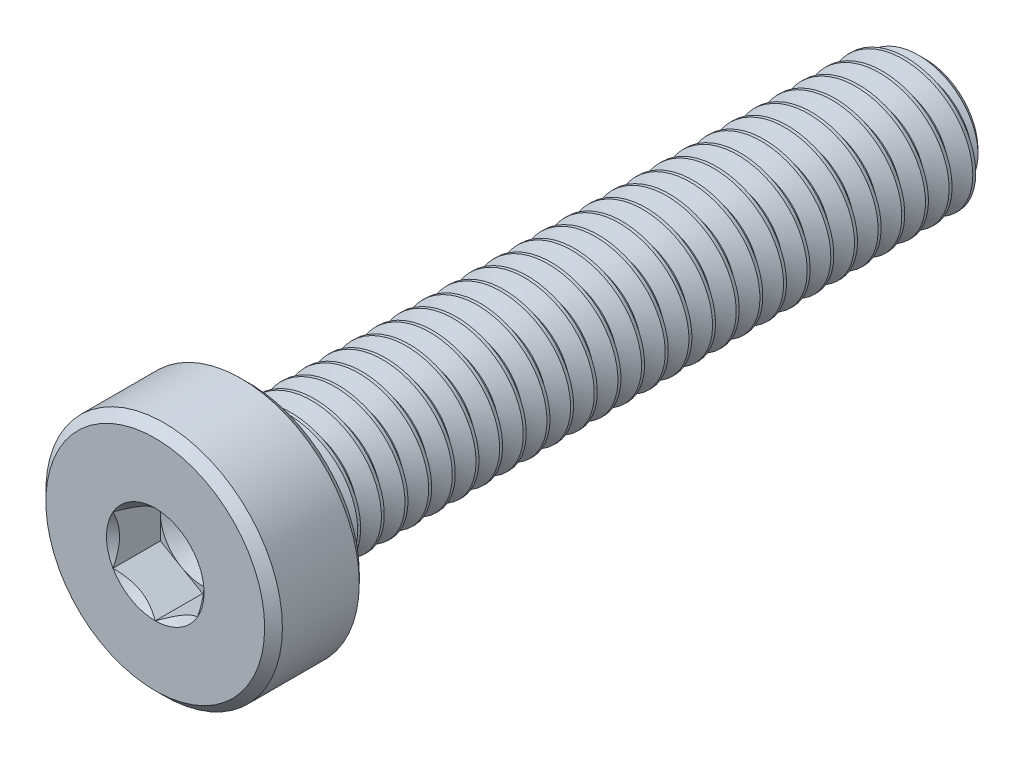
from build123d import *

# Parameters (mm, degrees)
CUT_EXTRUDE1_DEPTH = 1.4
CUT_SWEEP1_PITCH   = 0.7


with BuildPart() as part:
    # Sketch2 → Revolve1 (revolve)
    with BuildSketch(Plane(origin=(0, 0, 0), x_dir=(0, 0, -1), z_dir=(1, 0, 0)), mode=Mode.PRIVATE) as revolve1_sk:
        with BuildLine():
            Line((-8.8625, 3.5), (-8.6, 3.2375))
            Line((-8.6, 3.2375), (-8.6, 2.2))
            ThreePointArc((-8.6, 2.2), (-8.541421356, 2.058578644), (-8.4, 2))
            Line((-8.4, 2), (10.945336663, 2))
            Line((10.945336663, 2), (11.4, 1.545336663))
            Line((11.4, 1.545336663), (11.4, 0))
            Line((11.4, 0), (-10, 0))
            Line((-10, 0), (-10, 1.25))
            Line((-10, 1.25), (-11.4, 1.25))
            Line((-11.4, 1.25), (-11.4, 3.2375))
            Line((-11.4, 3.2375), (-11.1375, 3.5))
            Line((-11.1375, 3.5), (-8.8625, 3.5))
        make_face()
    revolve(revolve1_sk.sketch.rotate(Axis((0, 0, 10), (0, 0, -1)), 90), axis=Axis((0, 0, 10), (0, 0, -1)))

    # Sketch3 → Cut-Extrude1 (cut)
    with BuildSketch(Plane.XY.offset(11.4)):
        Polygon((0, 1.443375673), (-1.25, 0.721687836), (-1.25, -0.721687836), (0, -1.443375673), (1.25, -0.721687836), (1.25, 0.721687836), align=None)
    extrude(amount=-CUT_EXTRUDE1_DEPTH, mode=Mode.SUBTRACT)

    # Cut-Extrude2 cone 1 section (through the dimple's axis) → Cut-Extrude2 (revolve, cut)
    with BuildSketch(Plane(origin=(0, 0, 11.4), x_dir=(0, -1, 0), z_dir=(1, 0, 0))):
        Polygon((0, 0), (1.443375673, 0), (0, 1.443375673), align=None)
    revolve(axis=Axis((0, 0, 11.4), (0, 0, -1)), mode=Mode.SUBTRACT)

    # Cut-Extrude5 cone 1 section (through the dimple's axis) → Cut-Extrude5 (revolve, cut)
    with BuildSketch(Plane(origin=(0, 0, 10), x_dir=(0, -1, 0), z_dir=(1, 0, 0))):
        Polygon((0, 0), (1.25, 0), (0, 0.721687836), align=None)
    revolve(axis=Axis((0, 0, 10), (0, 0, -1)), mode=Mode.SUBTRACT)

    # Cut-Sweep1: the profile of Sketch8 screwed along a right-hand helix of 29.196429 turns, 6 arcs to a turn; built about Z, then put on its axis
    cut_sweep1_z = Axis((0, 0, 0), (0, 0, 1))
    cut_sweep1_corners = [(2.037888611, 0, 0.021875), (2.037888611, 0, -0.634375), (1.545336663, 0, -0.35), (1.545336663, 0, -0.2625)]
    with BuildLine(mode=Mode.PRIVATE) as cut_sweep1_profile:
        Line(cut_sweep1_corners[0], cut_sweep1_corners[1])
        Line(cut_sweep1_corners[1], cut_sweep1_corners[2])
        Line(cut_sweep1_corners[2], cut_sweep1_corners[3])
        Line(cut_sweep1_corners[3], cut_sweep1_corners[0])
    cut_sweep1_cap = Face(cut_sweep1_profile.wire())
    cut_sweep1_turn_angles = [0, 30, 60, 90, 120, 150, 180, 210, 240, 270, 300, 330, 360]
    cut_sweep1_turn_weights = [1, 0.8660254037844387, 1, 0.8660254037844387, 1, 0.8660254037844387, 1, 0.8660254037844387, 1, 0.8660254037844387, 1, 0.8660254037844387, 1]
    cut_sweep1_turn_rails = [Edge.make_bspline([Vector(p[0], p[1], 0).rotate(cut_sweep1_z, cut_sweep1_turn_angles[k]) / cut_sweep1_turn_weights[k] + Vector(0, 0, p[2] + CUT_SWEEP1_PITCH * cut_sweep1_turn_angles[k] / 360) for k in range(13)], [0, 0, 0, 1, 1, 2, 2, 3, 3, 4, 4, 5, 5, 6, 6, 6], 2, cut_sweep1_turn_weights) for p in cut_sweep1_corners]
    cut_sweep1_turn_sides = [Face.make_surface_from_curves(cut_sweep1_turn_rails[p[0]], cut_sweep1_turn_rails[p[1]]) for p in [(0, 1), (1, 2), (2, 3), (3, 0)]]
    cut_sweep1_last_angles = [10440, 10470, 10500, 10505.357142857, 10510.714285714]
    cut_sweep1_last_weights = [1, 0.8660254037844387, 1, 0.9956320789410119, 1]
    cut_sweep1_last_rails = [Edge.make_bspline([Vector(p[0], p[1], 0).rotate(cut_sweep1_z, cut_sweep1_last_angles[k]) / cut_sweep1_last_weights[k] + Vector(0, 0, p[2] + CUT_SWEEP1_PITCH * cut_sweep1_last_angles[k] / 360) for k in range(5)], [0, 0, 0, 1, 1, 2, 2, 2], 2, cut_sweep1_last_weights) for p in cut_sweep1_corners]
    cut_sweep1_last_sides = [Face.make_surface_from_curves(cut_sweep1_last_rails[p[0]], cut_sweep1_last_rails[p[1]]) for p in [(0, 1), (1, 2), (2, 3), (3, 0)]]
    cut_sweep1 = Plane(origin=(0, 0, -11.4), x_dir=(0, 1, 0), z_dir=(0, 0, 1)) * Solid(Shell([*[p.moved(Location((0, 0, CUT_SWEEP1_PITCH * i))) for i in range(29) for p in cut_sweep1_turn_sides], *cut_sweep1_last_sides, cut_sweep1_cap, cut_sweep1_cap.rotate(cut_sweep1_z, 10510.714285714).moved(Location((0, 0, CUT_SWEEP1_PITCH * 10510.714285714 / 360)))]))
    add(cut_sweep1, mode=Mode.SUBTRACT)

    # Sketch9 → Revolve2 (revolve)
    with BuildSketch(Plane(origin=(0, 0, 0), x_dir=(0, 0, -1), z_dir=(1, 0, 0)), mode=Mode.PRIVATE) as revolve2_sk:
        with BuildLine():
            Line((-9.08125, 0), (-9.08125, 2.2))
            Line((-9.08125, 2.2), (-8.6, 2.2))
            ThreePointArc((-8.6, 2.2), (-8.541421356, 2.058578644), (-8.4, 2))
            Line((-8.4, 2), (-7.9, 2))
            Line((-7.9, 2), (-6.745299462, 0))
            Line((-6.745299462, 0), (-9.08125, 0))
        make_face()
    revolve(revolve2_sk.sketch.rotate(Axis((0, 0, 6.745299462), (0, 0, 1)), 270), axis=Axis((0, 0, 6.745299462), (0, 0, 1)))


solid = part.part
